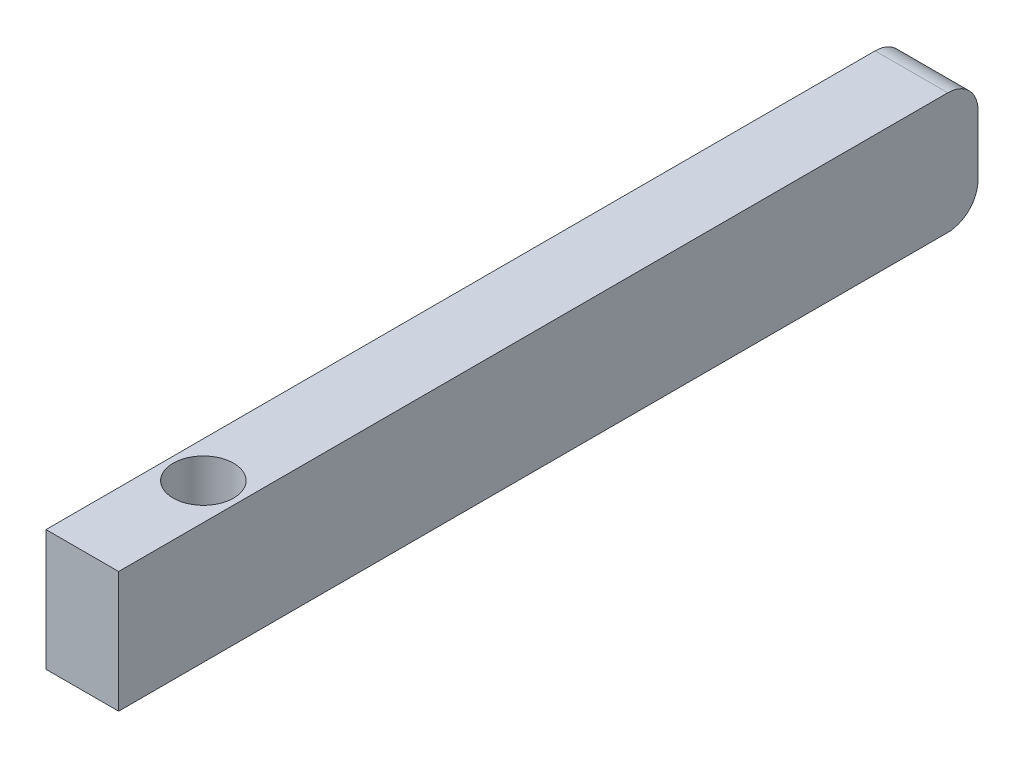
from build123d import *

# Parameters (mm, degrees)
SKETCH_1_W      = 1.2
SKETCH_1_H      = 14.2
SKETCH_1_R      = 0.5
EXTRUDE_1_DEPTH = 2
FILLET_1_R      = 0.5


with BuildPart() as part:
    # 草图1 → 凸台-拉伸1 (new body)
    with BuildSketch(Plane(origin=(0, 0, 0), x_dir=(1, 0, 0), z_dir=(0, 1, 0))):
        with Locations((0, 5.1)):
            Rectangle(SKETCH_1_W, SKETCH_1_H)
        Circle(SKETCH_1_R, mode=Mode.SUBTRACT)
    extrude(amount=EXTRUDE_1_DEPTH)

    # 圆角1
    fillet_1_edges = [part.edges().sort_by_distance(p)[0] for p in [
        (0, 2, -12.2),
        (0, 0, -12.2),
    ]]
    fillet(fillet_1_edges, radius=FILLET_1_R)


solid = part.part
